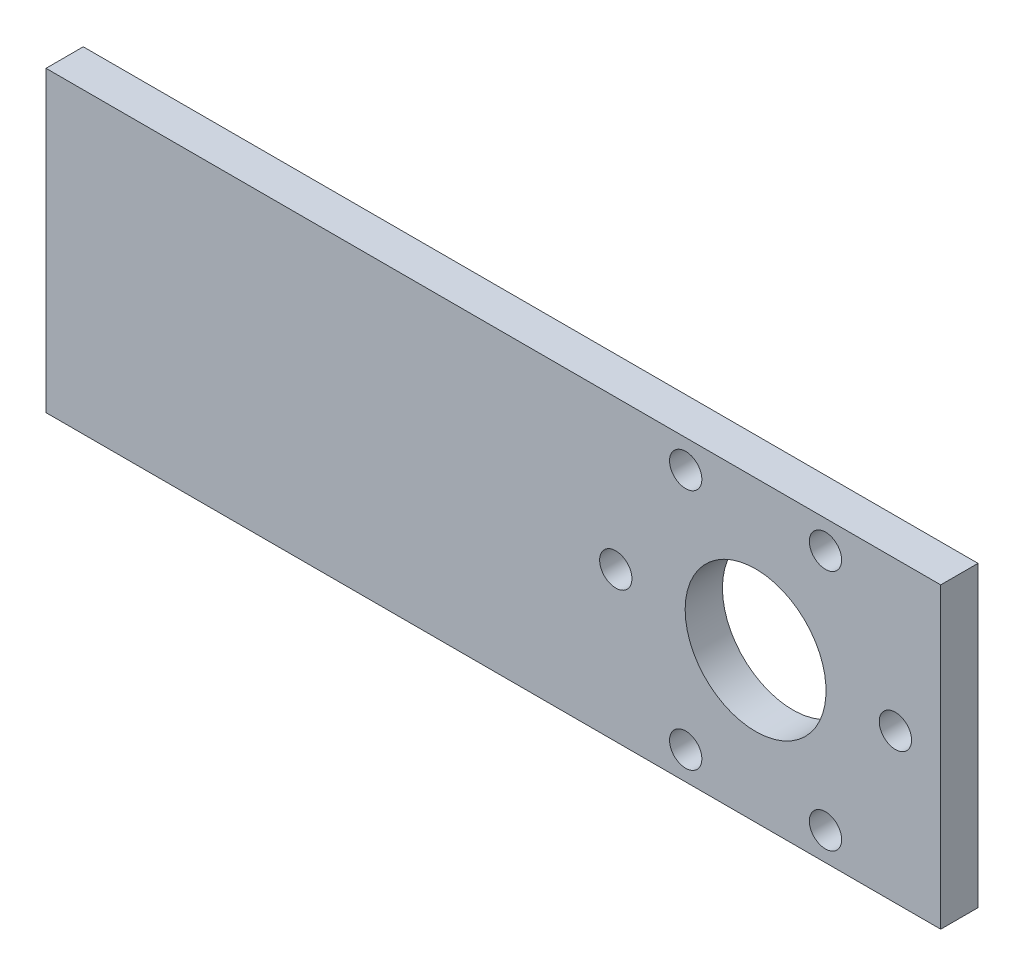
from build123d import *

# Parameters (mm, degrees)
SKETCH1_W           = 152.4
SKETCH1_H           = 50.8
BOSS_EXTRUDE1_DEPTH = 6.35
SKETCH2_R           = 12
CUT_EXTRUDE1_DEPTH  = 161.769159045
SKETCH3_R           = 2.75
CUT_EXTRUDE2_DEPTH  = 161.769159045


with BuildPart() as part:
    # Sketch1 → Boss-Extrude1 (new body)
    with BuildSketch(Plane.XY):
        with Locations((76.2, -25.4)):
            Rectangle(SKETCH1_W, SKETCH1_H)
    extrude(amount=BOSS_EXTRUDE1_DEPTH)

    # Sketch2 → Cut-Extrude1 (cut, through all)
    with BuildSketch(Plane(origin=(0, 0, 0), x_dir=(-1, 0, 0), z_dir=(0, 0, -1))):
        with Locations((-120.865956844, -25.4)):
            Circle(SKETCH2_R)
    extrude(amount=-CUT_EXTRUDE1_DEPTH, mode=Mode.SUBTRACT)

    # Sketch3 → Cut-Extrude2 (cut, through all)
    with BuildSketch(Plane(origin=(0, 0, 0), x_dir=(-1, 0, 0), z_dir=(0, 0, -1))):
        with Locations((-108.959706844, -4.777770072)):
            Circle(SKETCH3_R)
        with Locations((-132.772206844, -4.777770072)):
            Circle(SKETCH3_R)
        with Locations((-144.678456844, -25.4)):
            Circle(SKETCH3_R)
        with Locations((-132.772206844, -46.022229928)):
            Circle(SKETCH3_R)
        with Locations((-108.959706844, -46.022229928)):
            Circle(SKETCH3_R)
        with Locations((-97.053456844, -25.4)):
            Circle(SKETCH3_R)
    extrude(amount=-CUT_EXTRUDE2_DEPTH, mode=Mode.SUBTRACT)


solid = part.part
